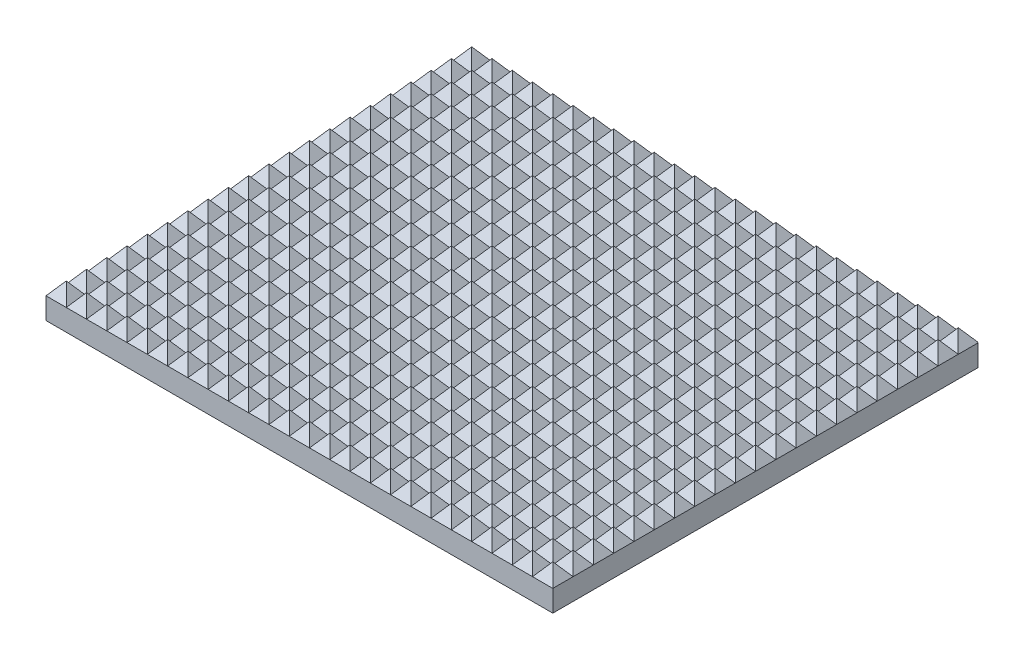
from build123d import *

# Parameters (mm, degrees)
SKETCH1_W           = 59
SKETCH1_H           = 49.5
SKETCH1_R           = 3
BOSS_EXTRUDE1_DEPTH = 1.5
BOSS_EXTRUDE2_DEPTH = 49.5
CUT_EXTRUDE1_DEPTH  = 1
BOSS_EXTRUDE3_START = 0.5
SKETCH5_R           = 3
BOSS_EXTRUDE3_DEPTH = 0.5
SKETCH6_W           = 3.5
SKETCH6_H           = 2.563301414
CUT_EXTRUDE4_DEPTH  = 0.5
CHAMFER3_SIZE       = 1.5
CUT_EXTRUDE6_DEPTH  = 65.105869466


with BuildPart() as part:
    # Sketch1 → Boss-Extrude1 (new body)
    with BuildSketch(Plane(origin=(0, 0, 0), x_dir=(1, 0, 0), z_dir=(0, 1, 0))):
        Rectangle(SKETCH1_W, SKETCH1_H)
        with Locations(Location((0, 0, 0), (0, 0, 270))):
            Circle(SKETCH1_R, mode=Mode.SUBTRACT)
    extrude(amount=BOSS_EXTRUDE1_DEPTH)

    # Sketch2 → Boss-Extrude2 (add)
    with BuildSketch(Plane(origin=(0, 0, -24.75), x_dir=(-1, 0, 0), z_dir=(0, 0, -1))):
        Polygon((-29.5, 1.5), (29.5, 1.5), (29.5, 2.5), (28.32, 4), (27.14, 2.5), (25.96, 4), (24.78, 2.5), (23.6, 4), (22.42, 2.5), (21.24, 4), (20.06, 2.5), (18.88, 4), (17.7, 2.5), (16.52, 4), (15.34, 2.5), (14.16, 4), (12.98, 2.5), (11.8, 4), (10.62, 2.5), (9.44, 4), (8.26, 2.5), (7.08, 4), (5.9, 2.5), (4.72, 4), (3.54, 2.5), (2.36, 4), (1.18, 2.5), (0, 4), (-1.18, 2.5), (-2.36, 4), (-3.54, 2.5), (-4.72, 4), (-5.9, 2.5), (-7.08, 4), (-8.26, 2.5), (-9.44, 4), (-10.62, 2.5), (-11.8, 4), (-12.98, 2.5), (-14.16, 4), (-15.34, 2.5), (-16.52, 4), (-17.7, 2.5), (-18.88, 4), (-20.06, 2.5), (-21.24, 4), (-22.42, 2.5), (-23.6, 4), (-24.78, 2.5), (-25.96, 4), (-27.14, 2.5), (-28.32, 4), (-29.5, 2.5), align=None)
    extrude(amount=-BOSS_EXTRUDE2_DEPTH)

    # Sketch3 → Cut-Extrude1 (cut)
    with BuildSketch(Plane(origin=(0, 0, 0), x_dir=(-1, 0, 0), z_dir=(0, -1, 0))):
        with BuildLine():
            Line((-1.75, -2.436698586), (-1.75, -5))
            Line((-1.75, -5), (1.75, -5))
            Line((1.75, -5), (1.75, -2.436698586))
            ThreePointArc((1.75, -2.436698586), (0, 3), (-1.75, -2.436698586))
        make_face()
    extrude(amount=-CUT_EXTRUDE1_DEPTH, mode=Mode.SUBTRACT)

    # Sketch5 → Boss-Extrude3 (add)
    with BuildSketch(Plane.XZ.offset(-1.5).offset(BOSS_EXTRUDE3_START)):
        Circle(SKETCH5_R)
    extrude(amount=-BOSS_EXTRUDE3_DEPTH)

    # Sketch6 → Cut-Extrude4 (cut)
    with BuildSketch(Plane.XZ.offset(-1)):
        with Locations((0, 3.718349293)):
            Rectangle(SKETCH6_W, SKETCH6_H)
    extrude(amount=-CUT_EXTRUDE4_DEPTH, mode=Mode.SUBTRACT)

    # Chamfer3
    chamfer3_edges = [part.edges().sort_by_distance(p)[0] for p in [
        (0, 0, 5),
    ]]
    chamfer(chamfer3_edges, length=CHAMFER3_SIZE - 0.0001)  # a hair under: the kernel refuses the full size

    # Sketch9 → Cut-Extrude6 (cut, through all)
    with BuildSketch(Plane(origin=(29.5, 0, 0), x_dir=(0, 0, -1), z_dir=(1, 0, 0))):
        Polygon((-24.75, 2.5), (-23.57, 4), (-22.39, 2.5), (-21.21, 4), (-20.03, 2.5), (-18.85, 4), (-17.67, 2.5), (-16.49, 4), (-15.31, 2.5), (-14.13, 4), (-12.95, 2.5), (-11.77, 4), (-10.59, 2.5), (-9.41, 4), (-8.23, 2.5), (-7.05, 4), (-5.87, 2.5), (-4.69, 4), (-3.51, 2.5), (-2.33, 4), (-1.15, 2.5), (0.03, 4), (1.21, 2.5), (2.39, 4), (3.57, 2.5), (4.75, 4), (5.93, 2.5), (7.11, 4), (8.29, 2.5), (9.47, 4), (10.65, 2.5), (11.83, 4), (13.01, 2.5), (14.19, 4), (15.37, 2.5), (16.55, 4), (17.73, 2.5), (18.91, 4), (20.09, 2.5), (21.27, 4), (22.45, 2.5), (23.63, 4), (24.81, 2.5), (24.81, 6.408846191), (-24.75, 6.408846191), align=None)
    extrude(amount=-CUT_EXTRUDE6_DEPTH, mode=Mode.SUBTRACT)


solid = part.part
